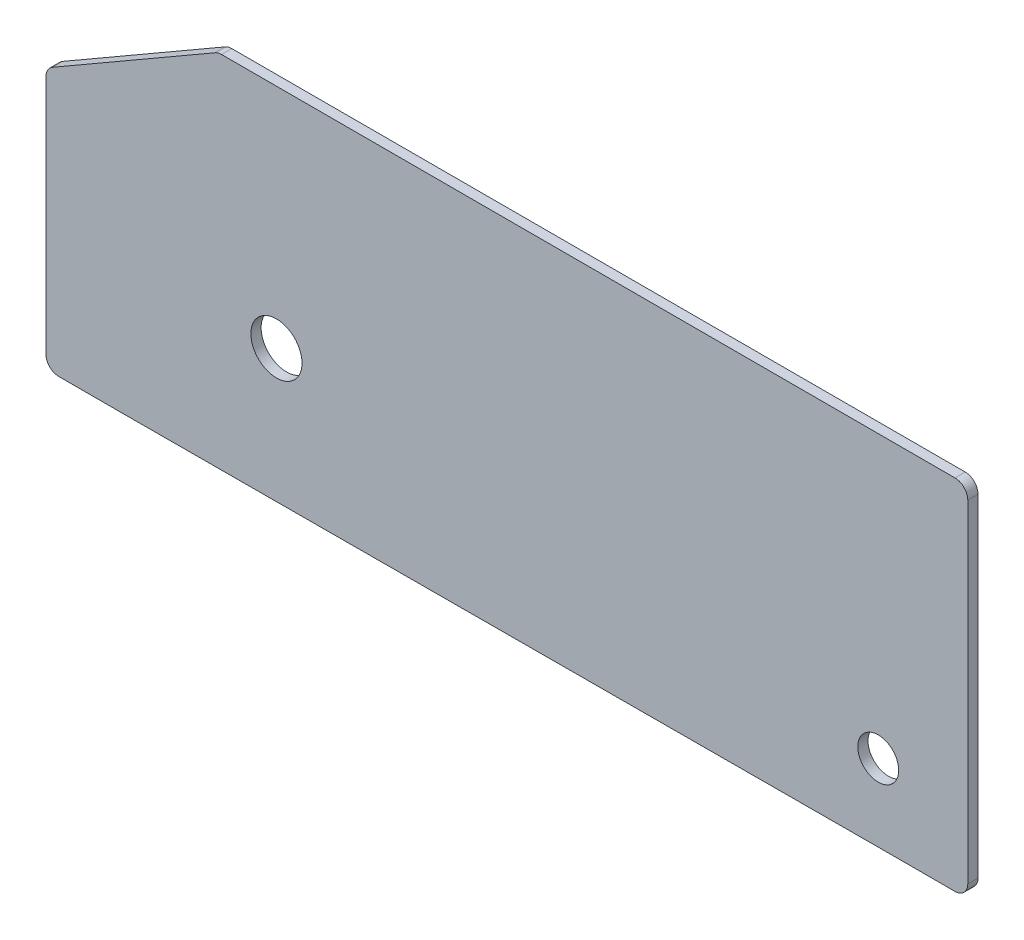
from build123d import *

# Parameters (mm, degrees)
BASE_FLANGE1_DEPTH = 2
SKETCH2_R          = 5
CUT_EXTRUDE1_DEPTH = 10
SKETCH4_R          = 4
CUT_EXTRUDE3_DEPTH = 10


# Sheet-metal steps are written as plain solids
with BuildPart() as part:
    # Sketch1 → Base-Flange1 (new body)
    with BuildSketch(Plane.XY):
        with BuildLine():
            Line((16.661890932, 10.015815157), (4.161890932, 10.015815157))
            Line((4.161890932, 10.015815157), (-146.015023604, 9.593165426))
            Line((-146.015023604, 9.593165426), (-158.515023604, 9.593165426))
            ThreePointArc((-158.515023604, 9.593165426), (-160.282790557, 10.325398473), (-161.015023604, 12.093165426))
            Line((-161.015023604, 12.093165426), (-161.015023604, 59.149789753))
            ThreePointArc((-161.015023604, 59.149789753), (-160.680087113, 60.399789753), (-159.765023604, 61.314853262))
            Line((-159.765023604, 61.314853262), (-127.954134471, 79.680878666))
            ThreePointArc((-127.954134471, 79.680878666), (-127.351182084, 79.930629722), (-126.704134471, 80.015815157))
            Line((-126.704134471, 80.015815157), (16.661890932, 80.015815157))
            ThreePointArc((16.661890932, 80.015815157), (18.429657885, 79.28358211), (19.161890932, 77.515815157))
            Line((19.161890932, 77.515815157), (19.161890932, 12.515815157))
            ThreePointArc((19.161890932, 12.515815157), (18.429657885, 10.748048204), (16.661890932, 10.015815157))
        make_face()
    extrude(amount=-BASE_FLANGE1_DEPTH)

    # Sketch2 → Cut-Extrude1 (cut)
    with BuildSketch(Plane(origin=(0, 0, -2), x_dir=(-1, 0, 0), z_dir=(0, 0, -1))):
        with Locations((115.97079497, 35.621477589)):
            Circle(SKETCH2_R)
    extrude(amount=-CUT_EXTRUDE1_DEPTH, mode=Mode.SUBTRACT)

    # Sketch4 → Cut-Extrude3 (cut)
    with BuildSketch(Plane.XY):
        with Locations((1.661890932, 25.015815157)):
            Circle(SKETCH4_R)
    extrude(amount=-CUT_EXTRUDE3_DEPTH, mode=Mode.SUBTRACT)


solid = part.part
